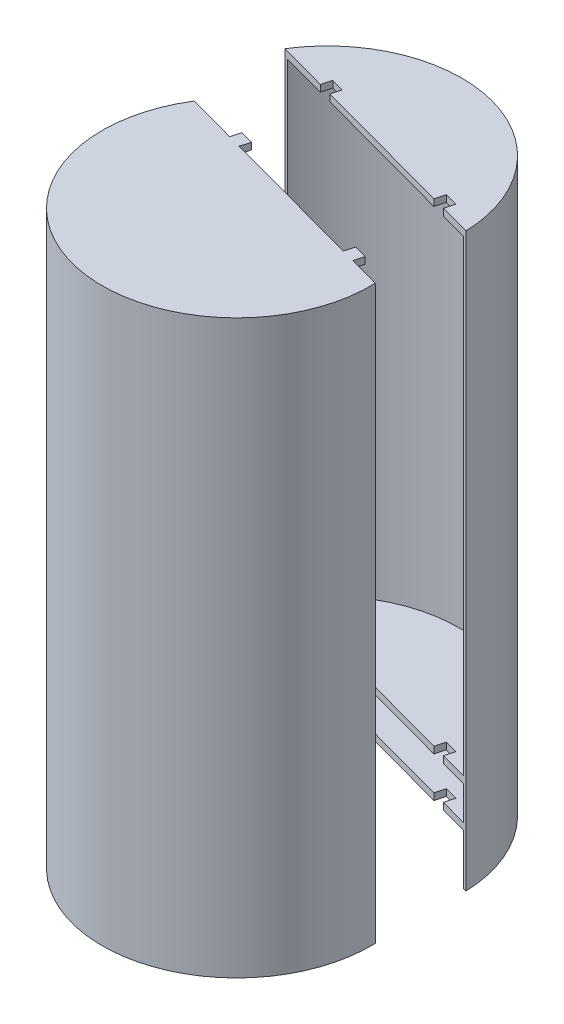
from build123d import *

# Parameters (mm, degrees)
SKETCH1_R               = 40
BOSS_EXTRUDE1_DEPTH     = 170
SKETCH3_R               = 39
CUT_EXTRUDE1_DEPTH      = 153
CUT_EXTRUDE2_START      = -15
SKETCH5_R               = 39
CUT_EXTRUDE2_DEPTH      = 15
SKETCH6_R               = 40
BOSS_EXTRUDE2_DEPTH     = 2
SKETCH12_R              = 15
CUT_EXTRUDE5_DEPTH      = 19
CUT_EXTRUDE6_DEPTH      = 19
SKETCH16_R              = 3.088837779
CUT_EXTRUDE7_DEPTH      = 19
SKETCH17_R              = 3
CUT_EXTRUDE8_DEPTH      = 19
SKETCH18_R              = 6.5
CUT_EXTRUDE9_DEPTH      = 19
BOSS_EXTRUDE3_START     = -2
SKETCH19_R              = 40
BOSS_EXTRUDE3_DEPTH     = 2
SPLIT1_SURFACE_1_BACK   = 205.206
SPLIT1_SURFACE_1_DEPTH  = 410.412
SPLIT1_SURFACE_2_BACK   = 205.206
SPLIT1_SURFACE_2_DEPTH  = 410.412
BODY_MOVE_COPY1_DEPTH   = 170
BODY_MOVE_COPY1_START   = 29
BODY_MOVE_COPY1_2_DEPTH = 139
BODY_MOVE_COPY1_3_DEPTH = 15
BODY_MOVE_COPY1_START_2 = 17
BODY_MOVE_COPY1_4_DEPTH = 10
BODY_MOVE_COPY1_5_DEPTH = 170
BODY_MOVE_COPY1_START_3 = 15
BODY_MOVE_COPY1_6_DEPTH = 2
BODY_MOVE_COPY1_START_4 = 27
BODY_MOVE_COPY1_7_DEPTH = 2
BODY_MOVE_COPY1_START_5 = 168
BODY_MOVE_COPY1_8_DEPTH = 2


# Read off the part's stored shape, not the designer's step: Body-Move/Copy1
with BuildPart() as part:
    # Sketch1 → Boss-Extrude1 (new body)
    with BuildSketch(Plane(origin=(0, 0, 0), x_dir=(1, 0, 0), z_dir=(0, 1, 0))):
        with Locations(Location((0, 0, 0), (0, 0, 270))):
            Circle(SKETCH1_R)
    extrude(amount=BOSS_EXTRUDE1_DEPTH)

    # Sketch3 → Cut-Extrude1 (cut)
    with BuildSketch(Plane(origin=(0, 170, 0), x_dir=(1, 0, 0), z_dir=(0, 1, 0))):
        with Locations(Location((0, 0, 0), (0, 0, 270))):
            Circle(SKETCH3_R)
    extrude(amount=-CUT_EXTRUDE1_DEPTH, mode=Mode.SUBTRACT)

    # Sketch5 → Cut-Extrude2 (cut)
    with BuildSketch(Plane.XZ.offset(CUT_EXTRUDE2_START)):
        with Locations(Location((0, 0, 0), (0, 0, 90))):
            Circle(SKETCH5_R)
    extrude(amount=CUT_EXTRUDE2_DEPTH, mode=Mode.SUBTRACT)

    # Sketch6 → Boss-Extrude2 (add)
    with BuildSketch(Plane(origin=(0, 27, 0), x_dir=(1, 0, 0), z_dir=(0, 1, 0))):
        with Locations(Location((0, 0, 0), (0, 0, 270))):
            Circle(SKETCH6_R)
    extrude(amount=BOSS_EXTRUDE2_DEPTH)

    # Sketch12 → Cut-Extrude5 (cut)
    with BuildSketch(Plane(origin=(0, 17, 0), x_dir=(1, 0, 0), z_dir=(0, 1, 0))):
        with Locations(Location((0, -7.590009818, 0), (0, 0, 270))):
            Circle(SKETCH12_R)
    extrude(amount=CUT_EXTRUDE5_DEPTH, mode=Mode.SUBTRACT)

    # Sketch15 → Cut-Extrude6 (cut)
    with BuildSketch(Plane(origin=(0, 17, 0), x_dir=(1, 0, 0), z_dir=(0, 1, 0))):
        with BuildLine():
            ThreePointArc((11.174993965, -6.645365205), (2.384185489, 3.45521331), (-9.64910652, -2.418446828))
            Line((-9.64910652, -2.418446828), (11.174993965, -6.645365205))
        make_face()
        with BuildLine():
            Line((9.986768127, -12.339026438), (-10.774875926, -8.124785595))
            ThreePointArc((-10.774875926, -8.124785595), (-1.992172654, -18.105108798), (9.986768127, -12.339026438))
        make_face()
    extrude(amount=-CUT_EXTRUDE6_DEPTH, mode=Mode.SUBTRACT)

    # Sketch16 → Cut-Extrude7 (cut)
    with BuildSketch(Plane.XZ.offset(-15)):
        with Locations(Location((-0.417469766, 30.413602278, 0), (0, 0, 90))):
            Circle(SKETCH16_R)
    extrude(amount=-CUT_EXTRUDE7_DEPTH, mode=Mode.SUBTRACT)

    # Sketch17 → Cut-Extrude8 (cut)
    with BuildSketch(Plane(origin=(0, 29, 0), x_dir=(1, 0, 0), z_dir=(0, 1, 0))):
        with Locations(Location((26.738607031, -12.822711748, 0), (0, 0, 270))):
            Circle(SKETCH17_R)
    extrude(amount=-CUT_EXTRUDE8_DEPTH, mode=Mode.SUBTRACT)

    # Sketch18 → Cut-Extrude9 (cut)
    with BuildSketch(Plane(origin=(0, 29, 0), x_dir=(1, 0, 0), z_dir=(0, 1, 0))):
        with Locations(Location((-27.317556841, -0.444207085, 0), (0, 0, 270))):
            Circle(SKETCH18_R)
    extrude(amount=-CUT_EXTRUDE9_DEPTH, mode=Mode.SUBTRACT)

    # Sketch19 → Boss-Extrude3 (add)
    with BuildSketch(Plane(origin=(0, 170, 0), x_dir=(1, 0, 0), z_dir=(0, 1, 0)).offset(BOSS_EXTRUDE3_START)):
        with Locations(Location((0, 0, 0), (0, 0, 270))):
            Circle(SKETCH19_R)
    extrude(amount=BOSS_EXTRUDE3_DEPTH)


with BuildPart() as body_2:
    # Split1: the piece behind the surface
    add(part.part)
    # Split1 surface: a surface, the sketch's curves swept straight by 410.412 mm
    with BuildLine(Plane(origin=(0, 170, 0), x_dir=(1, 0, 0), z_dir=(0, 1, 0)).offset(-SPLIT1_SURFACE_1_BACK), mode=Mode.PRIVATE) as split1_surface_1_path:
        Line((-33.883669555, 21.257867661), (-19.406133031, 17.333465005))
        Line((-19.406133031, 17.333465005), (-18.6212525, 20.22897231))
        Line((-18.6212525, 20.22897231), (-14.760576094, 19.182464935))
        Line((-14.760576094, 19.182464935), (-15.545456625, 16.28695763))
        Line((-15.545456625, 16.28695763), (26.921983844, 4.775376504))
        Line((26.921983844, 4.775376504), (27.706864375, 7.670883809))
        Line((27.706864375, 7.670883809), (31.567540782, 6.624376434))
        Line((31.567540782, 6.624376434), (30.78266025, 3.728869129))
        Line((30.78266025, 3.728869129), (45.260196774, -0.195533527))
    split1_surface_1 = Shell.extrude(split1_surface_1_path.wire(), (0 * SPLIT1_SURFACE_1_DEPTH, 1 * SPLIT1_SURFACE_1_DEPTH, 0 * SPLIT1_SURFACE_1_DEPTH))
    split(bisect_by=split1_surface_1, keep=Keep.BOTTOM)


with BuildPart() as part_1:
    add(part.part)

    # Split1: split by a surface, the side it looks to stays
    # Split1 surface: a surface, the sketch's curves swept straight by 410.412 mm
    with BuildLine(Plane(origin=(0, 170, 0), x_dir=(1, 0, 0), z_dir=(0, 1, 0)).offset(-SPLIT1_SURFACE_2_BACK), mode=Mode.PRIVATE) as split1_surface_2_path:
        Line((-33.883669555, 21.257867661), (-19.406133031, 17.333465005))
        Line((-19.406133031, 17.333465005), (-18.6212525, 20.22897231))
        Line((-18.6212525, 20.22897231), (-14.760576094, 19.182464935))
        Line((-14.760576094, 19.182464935), (-15.545456625, 16.28695763))
        Line((-15.545456625, 16.28695763), (26.921983844, 4.775376504))
        Line((26.921983844, 4.775376504), (27.706864375, 7.670883809))
        Line((27.706864375, 7.670883809), (31.567540782, 6.624376434))
        Line((31.567540782, 6.624376434), (30.78266025, 3.728869129))
        Line((30.78266025, 3.728869129), (45.260196774, -0.195533527))
    split1_surface_2 = Shell.extrude(split1_surface_2_path.wire(), (0 * SPLIT1_SURFACE_2_DEPTH, 1 * SPLIT1_SURFACE_2_DEPTH, 0 * SPLIT1_SURFACE_2_DEPTH))
    split(bisect_by=split1_surface_2, keep=Keep.TOP)

    # Body-Move/Copy1 outline → Body-Move/Copy1 (cut)
    with BuildSketch(Plane(origin=(0, 0, 0), x_dir=(1, 0, 0), z_dir=(0, 1, 0))):
        with BuildLine():
            ThreePointArc((39.980914288, 1.235513127), (35.157526041, 19.077430715), (22.828025818, 32.846327607))
            Line((22.828025818, 32.846327607), (-3.114608044, 39.878555851))
            ThreePointArc((-3.114608044, 39.878555851), (-20.70991655, 34.221328971), (-33.883669555, 21.257867661))
            Line((-33.883669555, 21.257867661), (-19.406133031, 17.333465005))
            Line((-19.406133031, 17.333465005), (-18.6212525, 20.22897231))
            Line((-18.6212525, 20.22897231), (-14.760576094, 19.182464935))
            Line((-14.760576094, 19.182464935), (-15.545456625, 16.28695763))
            Line((-15.545456625, 16.28695763), (26.921983844, 4.775376504))
            Line((26.921983844, 4.775376504), (27.706864375, 7.670883809))
            Line((27.706864375, 7.670883809), (31.567540782, 6.624376434))
            Line((31.567540782, 6.624376434), (30.78266025, 3.728869129))
            Line((30.78266025, 3.728869129), (39.980914288, 1.235513127))
        make_face()
    extrude(amount=BODY_MOVE_COPY1_DEPTH, mode=Mode.SUBTRACT)

    # Body-Move_Copy1 2 outline → Body-Move_Copy1 2 (cut)
    with BuildSketch(Plane(origin=(0, 0, 0), x_dir=(1, 0, 0), z_dir=(0, 1, 0)).offset(BODY_MOVE_COPY1_START)):
        with BuildLine():
            Line((19.586174582, 33.725091034), (22.828025818, 32.846327607))
            ThreePointArc((22.828025818, 32.846327607), (10.46507375, 38.606764063), (-3.114608044, 39.878555851))
            Line((-3.114608044, 39.878555851), (0.127243191, 38.999792425))
            ThreePointArc((0.127243191, 38.999792425), (10.203446906, 37.641594961), (19.586174582, 33.725091034))
        make_face()
    extrude(amount=BODY_MOVE_COPY1_2_DEPTH, mode=Mode.SUBTRACT)

    # Body-Move_Copy1 3 outline → Body-Move_Copy1 3 (cut)
    with BuildSketch(Plane(origin=(0, 0, 0), x_dir=(1, 0, 0), z_dir=(0, 1, 0))):
        with BuildLine():
            Line((19.586174582, 33.725091034), (22.828025818, 32.846327607))
            ThreePointArc((22.828025818, 32.846327607), (10.46507375, 38.606764063), (-3.114608044, 39.878555851))
            Line((-3.114608044, 39.878555851), (0.127243191, 38.999792425))
            ThreePointArc((0.127243191, 38.999792425), (10.203446906, 37.641594961), (19.586174582, 33.725091034))
        make_face()
    extrude(amount=BODY_MOVE_COPY1_3_DEPTH, mode=Mode.SUBTRACT)

    # Body-Move_Copy1 4 outline → Body-Move_Copy1 4 (cut)
    with BuildSketch(Plane(origin=(0, 0, 0), x_dir=(1, 0, 0), z_dir=(0, 1, 0)).offset(BODY_MOVE_COPY1_START_2)):
        with BuildLine():
            Line((19.586174582, 33.725091034), (22.828025818, 32.846327607))
            ThreePointArc((22.828025818, 32.846327607), (10.46507375, 38.606764063), (-3.114608044, 39.878555851))
            Line((-3.114608044, 39.878555851), (0.127243191, 38.999792425))
            ThreePointArc((0.127243191, 38.999792425), (10.203446906, 37.641594961), (19.586174582, 33.725091034))
        make_face()
    extrude(amount=BODY_MOVE_COPY1_4_DEPTH, mode=Mode.SUBTRACT)



with BuildPart() as body_3:
    # Body-Move_Copy1 5 outline → Body-Move_Copy1 5 (new body)
    with BuildSketch(Plane(origin=(0, 0, 0), x_dir=(1, 0, 0), z_dir=(0, 1, 0))):
        with BuildLine():
            ThreePointArc((-32.873538292, 47.945261449), (10.203446907, 64.602803414), (38.970783025, 28.470536245))
            Line((38.970783025, 28.470536245), (39.980914288, 28.19672158))
            ThreePointArc((39.980914288, 28.19672158), (10.46507375, 65.567972515), (-33.883669555, 48.219076114))
            Line((-33.883669555, 48.219076114), (-32.873538292, 47.945261449))
        make_face()
    extrude(amount=BODY_MOVE_COPY1_5_DEPTH)


with BuildPart() as part_2:
    add(part_1.part)

    add(body_3.part)  # Body-Move_Copy1 6 merges body 3
    # Body-Move_Copy1 6 outline → Body-Move_Copy1 6 (add)
    with BuildSketch(Plane(origin=(0, 0, 0), x_dir=(1, 0, 0), z_dir=(0, 1, 0)).offset(BODY_MOVE_COPY1_START_3)):
        with BuildLine():
            Line((31.567540782, 33.585584886), (30.78266025, 30.690077582))
            Line((30.78266025, 30.690077582), (38.970783025, 28.470536245))
            ThreePointArc((38.970783025, 28.470536245), (10.203446907, 64.602803414), (-32.873538292, 47.945261449))
            Line((-32.873538292, 47.945261449), (-19.406133031, 44.294673457))
            Line((-19.406133031, 44.294673457), (-18.6212525, 47.190180762))
            Line((-18.6212525, 47.190180762), (-14.760576094, 46.143673387))
            Line((-14.760576094, 46.143673387), (-15.545456625, 43.248166082))
            Line((-15.545456625, 43.248166082), (-3.114608044, 39.878555851))
            ThreePointArc((-3.114608044, 39.878555851), (10.46507375, 38.606764063), (22.828025818, 32.846327607))
            Line((22.828025818, 32.846327607), (26.921983844, 31.736584957))
            Line((26.921983844, 31.736584957), (27.706864375, 34.632092261))
            Line((27.706864375, 34.632092261), (31.567540782, 33.585584886))
        make_face()
    extrude(amount=BODY_MOVE_COPY1_6_DEPTH)

    # Body-Move_Copy1 7 outline → Body-Move_Copy1 7 (add)
    with BuildSketch(Plane(origin=(0, 0, 0), x_dir=(1, 0, 0), z_dir=(0, 1, 0)).offset(BODY_MOVE_COPY1_START_4)):
        with BuildLine():
            Line((31.567540782, 33.585584886), (30.78266025, 30.690077582))
            Line((30.78266025, 30.690077582), (38.970783025, 28.470536245))
            ThreePointArc((38.970783025, 28.470536245), (10.203446907, 64.602803414), (-32.873538292, 47.945261449))
            Line((-32.873538292, 47.945261449), (-19.406133031, 44.294673457))
            Line((-19.406133031, 44.294673457), (-18.6212525, 47.190180762))
            Line((-18.6212525, 47.190180762), (-14.760576094, 46.143673387))
            Line((-14.760576094, 46.143673387), (-15.545456625, 43.248166082))
            Line((-15.545456625, 43.248166082), (-3.114608044, 39.878555851))
            ThreePointArc((-3.114608044, 39.878555851), (10.46507375, 38.606764063), (22.828025818, 32.846327607))
            Line((22.828025818, 32.846327607), (26.921983844, 31.736584957))
            Line((26.921983844, 31.736584957), (27.706864375, 34.632092261))
            Line((27.706864375, 34.632092261), (31.567540782, 33.585584886))
        make_face()
    extrude(amount=BODY_MOVE_COPY1_7_DEPTH)

    # Body-Move_Copy1 8 outline → Body-Move_Copy1 8 (add)
    with BuildSketch(Plane(origin=(0, 0, 0), x_dir=(1, 0, 0), z_dir=(0, 1, 0)).offset(BODY_MOVE_COPY1_START_5)):
        with BuildLine():
            Line((31.567540782, 33.585584886), (30.78266025, 30.690077582))
            Line((30.78266025, 30.690077582), (38.970783025, 28.470536245))
            ThreePointArc((38.970783025, 28.470536245), (10.203446907, 64.602803414), (-32.873538292, 47.945261449))
            Line((-32.873538292, 47.945261449), (-19.406133031, 44.294673457))
            Line((-19.406133031, 44.294673457), (-18.6212525, 47.190180762))
            Line((-18.6212525, 47.190180762), (-14.760576094, 46.143673387))
            Line((-14.760576094, 46.143673387), (-15.545456625, 43.248166082))
            Line((-15.545456625, 43.248166082), (-3.114608044, 39.878555851))
            ThreePointArc((-3.114608044, 39.878555851), (10.46507375, 38.606764063), (22.828025818, 32.846327607))
            Line((22.828025818, 32.846327607), (26.921983844, 31.736584957))
            Line((26.921983844, 31.736584957), (27.706864375, 34.632092261))
            Line((27.706864375, 34.632092261), (31.567540782, 33.585584886))
        make_face()
    extrude(amount=BODY_MOVE_COPY1_8_DEPTH)


solid = Compound([body_2.part, part_2.part])
